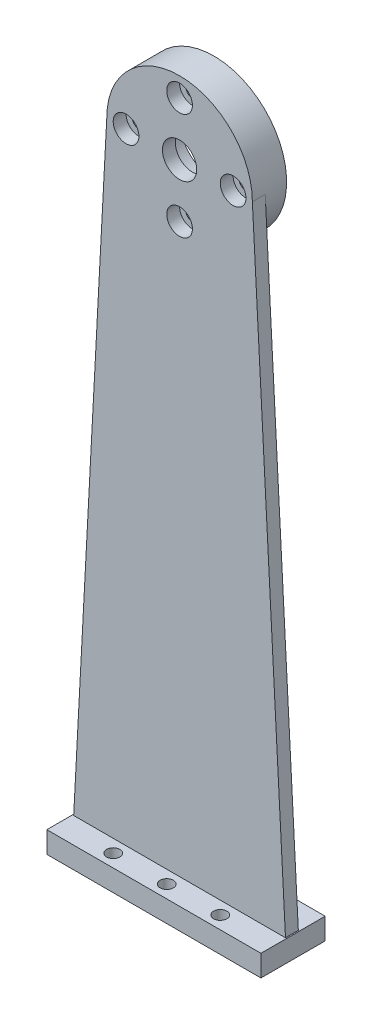
from build123d import *
from build123d.topology import SkipClean

# Parameters (mm, degrees)
SKETCH1_R           = 4
BOSS_EXTRUDE1_DEPTH = 3
BOSS_EXTRUDE2_START = 5
SKETCH2_R           = 17
SKETCH2_R_2         = 8
BOSS_EXTRUDE2_DEPTH = 5
SKETCH3_R           = 1.55
CUT_EXTRUDE1_DEPTH  = 8
SKETCH4_R           = 3
CUT_EXTRUDE2_DEPTH  = 3
SKETCH5_W           = 50
SKETCH5_H           = 15
SKETCH5_R           = 1.55
BOSS_EXTRUDE3_DEPTH = 5


with BuildPart() as part:
    # Sketch1 → Boss-Extrude1 (new body)
    with BuildSketch(Plane.XY):
        with BuildLine():
            Line((-25, 0), (25, 0))
            Line((25, 0), (17, 150))
            ThreePointArc((17, 150), (0, 167), (-17, 150))
            Line((-17, 150), (-25, 0))
        make_face()
        with Locations((0, 150)):
            Circle(SKETCH1_R, mode=Mode.SUBTRACT)
    extrude(amount=BOSS_EXTRUDE1_DEPTH)

    # Sketch2 → Boss-Extrude2 (add)
    with SkipClean():  # the faces are left unmerged after this step: merging them gives an invalid solid
        with BuildSketch(Plane(origin=(0, 0, 0), x_dir=(-1, 0, 0), z_dir=(0, 0, -1)).offset(BOSS_EXTRUDE2_START)):
            with Locations((0, 150)):
                Circle(SKETCH2_R)
            with Locations((0, 150)):
                Circle(SKETCH2_R_2, mode=Mode.SUBTRACT)
        extrude(amount=-BOSS_EXTRUDE2_DEPTH)

    # Sketch3 → Cut-Extrude1 (cut)
    with SkipClean():  # the faces are left unmerged after this step: merging them gives an invalid solid
        with BuildSketch(Plane.XY.offset(3)):
            with Locations((-12.5, 150)):
                Circle(SKETCH3_R)
            with Locations((0, 162.5)):
                Circle(SKETCH3_R)
            with Locations((12.5, 150)):
                Circle(SKETCH3_R)
            with Locations((0, 137.5)):
                Circle(SKETCH3_R)
        extrude(amount=-CUT_EXTRUDE1_DEPTH, mode=Mode.SUBTRACT)

    # Sketch4 → Cut-Extrude2 (cut)
    with SkipClean():  # the faces are left unmerged after this step: merging them gives an invalid solid
        with BuildSketch(Plane.XY.offset(3)):
            with Locations((-12.5, 150)):
                Circle(SKETCH4_R)
            with Locations((0, 162.5)):
                Circle(SKETCH4_R)
            with Locations((12.5, 150)):
                Circle(SKETCH4_R)
            with Locations((0, 137.5)):
                Circle(SKETCH4_R)
        extrude(amount=-CUT_EXTRUDE2_DEPTH, mode=Mode.SUBTRACT)

    # Sketch5 → Boss-Extrude3 (add)
    with SkipClean():  # the faces are left unmerged after this step: merging them gives an invalid solid
        with BuildSketch(Plane.XZ):
            with Locations((0, 1.5)):
                Rectangle(SKETCH5_W, SKETCH5_H)
            with Locations((-12.5, 6)):
                Circle(SKETCH5_R, mode=Mode.SUBTRACT)
            with Locations((0, 6)):
                Circle(SKETCH5_R, mode=Mode.SUBTRACT)
            with Locations((12.5, 6)):
                Circle(SKETCH5_R, mode=Mode.SUBTRACT)
            with Locations((0, -3)):
                Circle(SKETCH5_R, mode=Mode.SUBTRACT)
            with Locations((-12.5, -3)):
                Circle(SKETCH5_R, mode=Mode.SUBTRACT)
            with Locations((12.5, -3)):
                Circle(SKETCH5_R, mode=Mode.SUBTRACT)
        extrude(amount=-BOSS_EXTRUDE3_DEPTH)


solid = part.part
